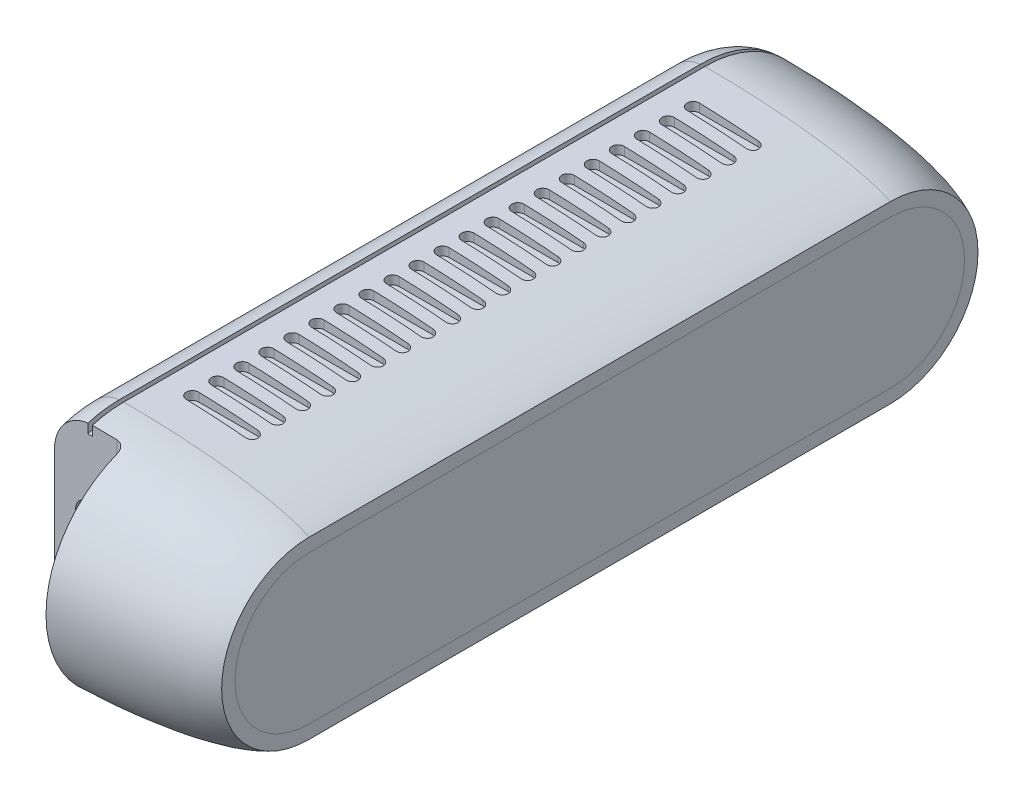
from build123d import *

# Parameters (mm, degrees)
BOSS_EXTRUDE1_DEPTH             = 32.5
REVOLVE1_ANGLE                  = 90
F_3_0MM_DOWEL_HOLE1_D           = 3
F_3_0MM_DOWEL_HOLE1_DEPTH       = 2.348709071
F_3_0MM_DOWEL_HOLE1_TIP         = 0.901290929
CUT_EXTRUDE1_DEPTH              = 53.974050407
CUT_EXTRUDE1_DEPTH_BACK         = 53.974050407
SKETCH13_W                      = 8
SKETCH13_H                      = 9
FILLET1_R                       = 1
CUT_EXTRUDE2_DEPTH              = 1
CUT_EXTRUDE3_DEPTH              = 5
BOSS_EXTRUDE2_REACH             = 59.228
F_1_4_0_25_DIAMETER_HOLE1_D     = 6.35
F_1_4_0_25_DIAMETER_HOLE1_DEPTH = 7.998267535
F_1_4_0_25_DIAMETER_HOLE1_TIP   = 1.907732465
THREAD1_PITCH                   = 1.27
CUT_EXTRUDE4_START              = -24
CUT_EXTRUDE4_DEPTH              = 1


with BuildPart() as part:
    # Sketch1 → Boss-Extrude1 (new body)
    with BuildSketch(Plane.XY):
        with BuildLine():
            Line((0, 0), (0, 8.25))
            ThreePointArc((0, 8.25), (1.072933743, 11.072897448), (3.75, 12.470485754))
            Line((3.75, 12.470485754), (3.75, 11.470485754))
            Line((3.75, 11.470485754), (4.25, 11.470485754))
            Line((4.25, 11.470485754), (4.25, 12.5))
            add(Edge.make_bspline(
                [(25, 9.795819234), (19.465709193, 12.5), (4.25, 12.5)],
                knots=[0.372260651, 0.372260651, 0.372260651, 1.570796327, 1.570796327, 1.570796327], degree=2, weights=[1, 0.825748803, 1]))
            Line((25, 9.795819234), (25, 0))
            Line((25, 0), (0, 0))
        make_face()
    extrude(amount=BOSS_EXTRUDE1_DEPTH)

    # Sketch5 → Revolve1 (revolve)
    with BuildSketch(Plane.XY.offset(32.5)):
        with BuildLine():
            Line((0, 0), (25, 0))
            Line((25, 0), (25, 9.795819234))
            add(Edge.make_bspline(
                [(25, 9.795819234), (19.465709193, 12.5), (4.25, 12.5)],
                knots=[0.372260651, 0.372260651, 0.372260651, 1.570796327, 1.570796327, 1.570796327], degree=2, weights=[1, 0.825748803, 1]))
            Line((4.25, 12.5), (4.25, 11.470485754))
            Line((4.25, 11.470485754), (3.75, 11.470485754))
            Line((3.75, 11.470485754), (3.75, 12.470485754))
            ThreePointArc((3.75, 12.470485754), (1.072933743, 11.072897448), (0, 8.25))
            Line((0, 8.25), (0, 0))
        make_face()
    revolve(axis=Axis((0, 0, 32.5), (1, 0, 0)), revolution_arc=REVOLVE1_ANGLE)

    # Mirror1: part across plane


with BuildPart() as part_1:
    add(part.part)
    add(part.part.mirror(Plane(origin=(4.25, 8.25, 0), x_dir=(1, 0, 0), z_dir=(0, 0, -1))))

    # Mirror2: part across plane


with BuildPart() as part_2:
    add(part_1.part)
    add(part_1.part.mirror(Plane(origin=(25, 0, 32.5), x_dir=(0, 0, 1), z_dir=(0, 1, 0))))

    # Ø3.0mm Dowel Hole1
    with Locations(Plane.ZY):
        with Locations((-22.5, 0), (22.5, 0)):
            Hole(F_3_0MM_DOWEL_HOLE1_D / 2, depth=F_3_0MM_DOWEL_HOLE1_DEPTH)
            with Locations((0, 0, -(F_3_0MM_DOWEL_HOLE1_DEPTH + F_3_0MM_DOWEL_HOLE1_TIP / 2))):  # 118° drill point
                Cone(0, F_3_0MM_DOWEL_HOLE1_D / 2, F_3_0MM_DOWEL_HOLE1_TIP, mode=Mode.SUBTRACT)

    # Sketch13 → Cut-Extrude1 (cut, two sides: drawn at the far end of the back side and taken through both)
    with BuildSketch(Plane(origin=(0, 0, 0), x_dir=(1, 0, 0), z_dir=(0, 1, 0)).offset(-CUT_EXTRUDE1_DEPTH_BACK)):
        with Locations((4, -40.5)):
            Rectangle(SKETCH13_W, SKETCH13_H)
    extrude(amount=CUT_EXTRUDE1_DEPTH + CUT_EXTRUDE1_DEPTH_BACK, mode=Mode.SUBTRACT)

    # Fillet1
    fillet1_edges = [part_2.edges().sort_by_distance(p)[0] for p in [
        (8, 0, 36),
    ]]
    fillet(fillet1_edges, radius=FILLET1_R)

    # Sketch15 → Cut-Extrude2 (cut)
    with BuildSketch(Plane(origin=(0, 12.5, 0), x_dir=(1, 0, 0), z_dir=(0, 1, 0))):
        with BuildLine():
            Line((14.05, -0.7), (7.45, -0.7))
            ThreePointArc((7.45, -0.7), (6.75, 0), (7.45, 0.7))
            Line((7.45, 0.7), (14.05, 0.7))
            ThreePointArc((14.05, 0.7), (14.75, 0), (14.05, -0.7))
        make_face()
        with BuildLine():
            Line((14.05, 2.1), (7.45, 2.1))
            ThreePointArc((7.45, 2.1), (6.75, 2.8), (7.45, 3.5))
            Line((7.45, 3.5), (14.05, 3.5))
            ThreePointArc((14.05, 3.5), (14.75, 2.8), (14.05, 2.1))
        make_face()
        with BuildLine():
            Line((14.05, 4.9), (7.45, 4.9))
            ThreePointArc((7.45, 4.9), (6.75, 5.6), (7.45, 6.3))
            Line((7.45, 6.3), (14.05, 6.3))
            ThreePointArc((14.05, 6.3), (14.75, 5.6), (14.05, 4.9))
        make_face()
        with BuildLine():
            Line((14.05, 7.7), (7.45, 7.7))
            ThreePointArc((7.45, 7.7), (6.75, 8.4), (7.45, 9.1))
            Line((7.45, 9.1), (14.05, 9.1))
            ThreePointArc((14.05, 9.1), (14.75, 8.4), (14.05, 7.7))
        make_face()
        with BuildLine():
            Line((14.05, 10.5), (7.45, 10.5))
            ThreePointArc((7.45, 10.5), (6.75, 11.2), (7.45, 11.9))
            Line((7.45, 11.9), (14.05, 11.9))
            ThreePointArc((14.05, 11.9), (14.75, 11.2), (14.05, 10.5))
        make_face()
        with BuildLine():
            Line((14.05, 13.3), (7.45, 13.3))
            ThreePointArc((7.45, 13.3), (6.75, 14), (7.45, 14.7))
            Line((7.45, 14.7), (14.05, 14.7))
            ThreePointArc((14.05, 14.7), (14.75, 14), (14.05, 13.3))
        make_face()
        with BuildLine():
            Line((14.05, 16.1), (7.45, 16.1))
            ThreePointArc((7.45, 16.1), (6.75, 16.8), (7.45, 17.5))
            Line((7.45, 17.5), (14.05, 17.5))
            ThreePointArc((14.05, 17.5), (14.75, 16.8), (14.05, 16.1))
        make_face()
        with BuildLine():
            Line((14.05, 18.9), (7.45, 18.9))
            ThreePointArc((7.45, 18.9), (6.75, 19.6), (7.45, 20.3))
            Line((7.45, 20.3), (14.05, 20.3))
            ThreePointArc((14.05, 20.3), (14.75, 19.6), (14.05, 18.9))
        make_face()
        with BuildLine():
            Line((14.05, 21.7), (7.45, 21.7))
            ThreePointArc((7.45, 21.7), (6.75, 22.4), (7.45, 23.1))
            Line((7.45, 23.1), (14.05, 23.1))
            ThreePointArc((14.05, 23.1), (14.75, 22.4), (14.05, 21.7))
        make_face()
        with BuildLine():
            Line((14.05, 24.5), (7.45, 24.5))
            ThreePointArc((7.45, 24.5), (6.75, 25.2), (7.45, 25.9))
            Line((7.45, 25.9), (14.05, 25.9))
            ThreePointArc((14.05, 25.9), (14.75, 25.2), (14.05, 24.5))
        make_face()
        with BuildLine():
            Line((14.05, 27.3), (7.45, 27.3))
            ThreePointArc((7.45, 27.3), (6.75, 28), (7.45, 28.7))
            Line((7.45, 28.7), (14.05, 28.7))
            ThreePointArc((14.05, 28.7), (14.75, 28), (14.05, 27.3))
        make_face()
        with BuildLine():
            Line((14.05, -3.5), (7.45, -3.5))
            ThreePointArc((7.45, -3.5), (6.75, -2.8), (7.45, -2.1))
            Line((7.45, -2.1), (14.05, -2.1))
            ThreePointArc((14.05, -2.1), (14.75, -2.8), (14.05, -3.5))
        make_face()
        with BuildLine():
            Line((14.05, -6.3), (7.45, -6.3))
            ThreePointArc((7.45, -6.3), (6.75, -5.6), (7.45, -4.9))
            Line((7.45, -4.9), (14.05, -4.9))
            ThreePointArc((14.05, -4.9), (14.75, -5.6), (14.05, -6.3))
        make_face()
        with BuildLine():
            Line((14.05, -9.1), (7.45, -9.1))
            ThreePointArc((7.45, -9.1), (6.75, -8.4), (7.45, -7.7))
            Line((7.45, -7.7), (14.05, -7.7))
            ThreePointArc((14.05, -7.7), (14.75, -8.4), (14.05, -9.1))
        make_face()
        with BuildLine():
            Line((14.05, -11.9), (7.45, -11.9))
            ThreePointArc((7.45, -11.9), (6.75, -11.2), (7.45, -10.5))
            Line((7.45, -10.5), (14.05, -10.5))
            ThreePointArc((14.05, -10.5), (14.75, -11.2), (14.05, -11.9))
        make_face()
        with BuildLine():
            Line((14.05, -14.7), (7.45, -14.7))
            ThreePointArc((7.45, -14.7), (6.75, -14), (7.45, -13.3))
            Line((7.45, -13.3), (14.05, -13.3))
            ThreePointArc((14.05, -13.3), (14.75, -14), (14.05, -14.7))
        make_face()
        with BuildLine():
            Line((14.05, -17.5), (7.45, -17.5))
            ThreePointArc((7.45, -17.5), (6.75, -16.8), (7.45, -16.1))
            Line((7.45, -16.1), (14.05, -16.1))
            ThreePointArc((14.05, -16.1), (14.75, -16.8), (14.05, -17.5))
        make_face()
        with BuildLine():
            Line((14.05, -20.3), (7.45, -20.3))
            ThreePointArc((7.45, -20.3), (6.75, -19.6), (7.45, -18.9))
            Line((7.45, -18.9), (14.05, -18.9))
            ThreePointArc((14.05, -18.9), (14.75, -19.6), (14.05, -20.3))
        make_face()
        with BuildLine():
            Line((14.05, -23.1), (7.45, -23.1))
            ThreePointArc((7.45, -23.1), (6.75, -22.4), (7.45, -21.7))
            Line((7.45, -21.7), (14.05, -21.7))
            ThreePointArc((14.05, -21.7), (14.75, -22.4), (14.05, -23.1))
        make_face()
        with BuildLine():
            Line((14.05, -25.9), (7.45, -25.9))
            ThreePointArc((7.45, -25.9), (6.75, -25.2), (7.45, -24.5))
            Line((7.45, -24.5), (14.05, -24.5))
            ThreePointArc((14.05, -24.5), (14.75, -25.2), (14.05, -25.9))
        make_face()
        with BuildLine():
            Line((14.05, -28.7), (7.45, -28.7))
            ThreePointArc((7.45, -28.7), (6.75, -28), (7.45, -27.3))
            Line((7.45, -27.3), (14.05, -27.3))
            ThreePointArc((14.05, -27.3), (14.75, -28), (14.05, -28.7))
        make_face()
    extrude(amount=-CUT_EXTRUDE2_DEPTH, mode=Mode.SUBTRACT)

    # Sketch16 → Cut-Extrude3 (cut)
    with BuildSketch(Plane.XY.offset(36)):
        with BuildLine():
            Line((5.37, 2.925), (5.37, -2.925))
            ThreePointArc((5.37, -2.925), (3.87, -4.425), (2.37, -2.925))
            Line((2.37, -2.925), (2.37, 2.925))
            ThreePointArc((2.37, 2.925), (3.87, 4.425), (5.37, 2.925))
        make_face()
    extrude(amount=-CUT_EXTRUDE3_DEPTH, mode=Mode.SUBTRACT)

    # Sketch17 → Boss-Extrude2 (add, up to next)
    with BuildSketch(Plane(origin=(0, -12.5, 0), x_dir=(-1, 0, 0), z_dir=(0, -1, 0)), mode=Mode.PRIVATE) as boss_extrude2_sk1:
        with BuildLine():
            Line((-4.25, -30.5), (-12.041958129, -29.25004005))
            ThreePointArc((-12.041958129, -29.25004005), (-15.055245764, -27.556629293), (-16.25, -24.313158208))
            Line((-16.25, -24.313158208), (-16.25, 24.313158208))
            ThreePointArc((-16.25, 24.313158208), (-15.055245764, 27.556629293), (-12.041958129, 29.25004005))
            Line((-12.041958129, 29.25004005), (-4.25, 30.5))
            Line((-4.25, 30.5), (-4.25, -30.5))
        make_face()
    boss_extrude2_tool1 = extrude(boss_extrude2_sk1.sketch, amount=-BOSS_EXTRUDE2_REACH, mode=Mode.PRIVATE) - part_2.part
    add(boss_extrude2_tool1.solids().sort_by_distance((10.131103, -12.5, 0))[0])

    # 1/4 (0.25) Diameter Hole1
    with Locations(Plane(origin=(0, -12.5, 0), x_dir=(-1, 0, 0), z_dir=(0, -1, 0))):
        with Locations((-9.6475, 0)):
            Hole(F_1_4_0_25_DIAMETER_HOLE1_D / 2, depth=F_1_4_0_25_DIAMETER_HOLE1_DEPTH)
            with Locations((0, 0, -(F_1_4_0_25_DIAMETER_HOLE1_DEPTH + F_1_4_0_25_DIAMETER_HOLE1_TIP / 2))):  # 118° drill point
                Cone(0, F_1_4_0_25_DIAMETER_HOLE1_D / 2, F_1_4_0_25_DIAMETER_HOLE1_TIP, mode=Mode.SUBTRACT)

    # Thread1: the profile of Thread Profile1 profile screwed along a right-hand helix of 6.297848 turns, 8 arcs to a turn; built about Z, then put on its axis
    thread1_z = Axis((0, 0, 0), (0, 0, 1))
    thread1_corners = [(3.1753, 0, -0.000173205), (3.1753, 0, 1.111423202), (2.487592339, 0, 0.714374998), (2.487592339, 0, 0.396874998)]
    with BuildLine(mode=Mode.PRIVATE) as thread1_profile:
        Line(thread1_corners[0], thread1_corners[1])
        Line(thread1_corners[1], thread1_corners[2])
        Line(thread1_corners[2], thread1_corners[3])
        Line(thread1_corners[3], thread1_corners[0])
    thread1_cap = Face(thread1_profile.wire())
    thread1_turn_angles = [0, 22.5, 45, 67.5, 90, 112.5, 135, 157.5, 180, 202.5, 225, 247.5, 270, 292.5, 315, 337.5, 360]
    thread1_turn_weights = [1, 0.9238795325112867, 1, 0.9238795325112867, 1, 0.9238795325112867, 1, 0.9238795325112867, 1, 0.9238795325112867, 1, 0.9238795325112867, 1, 0.9238795325112867, 1, 0.9238795325112867, 1]
    thread1_turn_rails = [Edge.make_bspline([Vector(p[0], p[1], 0).rotate(thread1_z, thread1_turn_angles[k]) / thread1_turn_weights[k] + Vector(0, 0, p[2] + THREAD1_PITCH * thread1_turn_angles[k] / 360) for k in range(17)], [0, 0, 0, 1, 1, 2, 2, 3, 3, 4, 4, 5, 5, 6, 6, 7, 7, 8, 8, 8], 2, thread1_turn_weights) for p in thread1_corners]
    thread1_turn_sides = [Face.make_surface_from_curves(thread1_turn_rails[p[0]], thread1_turn_rails[p[1]]) for p in [(0, 1), (1, 2), (2, 3), (3, 0)]]
    thread1_last_angles = [2160, 2182.5, 2205, 2227.5, 2250, 2258.612721438, 2267.225442875]
    thread1_last_weights = [1, 0.9238795325112867, 1, 0.9238795325112867, 1, 0.9887231551979407, 1]
    thread1_last_rails = [Edge.make_bspline([Vector(p[0], p[1], 0).rotate(thread1_z, thread1_last_angles[k]) / thread1_last_weights[k] + Vector(0, 0, p[2] + THREAD1_PITCH * thread1_last_angles[k] / 360) for k in range(7)], [0, 0, 0, 1, 1, 2, 2, 3, 3, 3], 2, thread1_last_weights) for p in thread1_corners]
    thread1_last_sides = [Face.make_surface_from_curves(thread1_last_rails[p[0]], thread1_last_rails[p[1]]) for p in [(0, 1), (1, 2), (2, 3), (3, 0)]]
    thread1 = Plane(origin=(9.6475, -12.5, 0), x_dir=(1, 0, 0), z_dir=(0, 1, 0)) * Solid(Shell([*[p.moved(Location((0, 0, THREAD1_PITCH * i))) for i in range(6) for p in thread1_turn_sides], *thread1_last_sides, thread1_cap, thread1_cap.rotate(thread1_z, 2267.225442875).moved(Location((0, 0, THREAD1_PITCH * 2267.225442875 / 360)))]))
    add(thread1)

    # Sketch15<2> → Cut-Extrude4 (cut)
    with BuildSketch(Plane(origin=(0, 12.5, 0), x_dir=(1, 0, 0), z_dir=(0, 1, 0)).offset(CUT_EXTRUDE4_START)):
        with BuildLine():
            Line((14.05, 4.9), (7.45, 4.9))
            ThreePointArc((7.45, 4.9), (6.75, 5.6), (7.45, 6.3))
            Line((7.45, 6.3), (14.05, 6.3))
            ThreePointArc((14.05, 6.3), (14.75, 5.6), (14.05, 4.9))
        make_face()
        with BuildLine():
            Line((14.05, 7.7), (7.45, 7.7))
            ThreePointArc((7.45, 7.7), (6.75, 8.4), (7.45, 9.1))
            Line((7.45, 9.1), (14.05, 9.1))
            ThreePointArc((14.05, 9.1), (14.75, 8.4), (14.05, 7.7))
        make_face()
        with BuildLine():
            Line((14.05, 10.5), (7.45, 10.5))
            ThreePointArc((7.45, 10.5), (6.75, 11.2), (7.45, 11.9))
            Line((7.45, 11.9), (14.05, 11.9))
            ThreePointArc((14.05, 11.9), (14.75, 11.2), (14.05, 10.5))
        make_face()
        with BuildLine():
            Line((14.05, 13.3), (7.45, 13.3))
            ThreePointArc((7.45, 13.3), (6.75, 14), (7.45, 14.7))
            Line((7.45, 14.7), (14.05, 14.7))
            ThreePointArc((14.05, 14.7), (14.75, 14), (14.05, 13.3))
        make_face()
        with BuildLine():
            Line((14.05, 16.1), (7.45, 16.1))
            ThreePointArc((7.45, 16.1), (6.75, 16.8), (7.45, 17.5))
            Line((7.45, 17.5), (14.05, 17.5))
            ThreePointArc((14.05, 17.5), (14.75, 16.8), (14.05, 16.1))
        make_face()
        with BuildLine():
            Line((14.05, 18.9), (7.45, 18.9))
            ThreePointArc((7.45, 18.9), (6.75, 19.6), (7.45, 20.3))
            Line((7.45, 20.3), (14.05, 20.3))
            ThreePointArc((14.05, 20.3), (14.75, 19.6), (14.05, 18.9))
        make_face()
        with BuildLine():
            Line((14.05, 21.7), (7.45, 21.7))
            ThreePointArc((7.45, 21.7), (6.75, 22.4), (7.45, 23.1))
            Line((7.45, 23.1), (14.05, 23.1))
            ThreePointArc((14.05, 23.1), (14.75, 22.4), (14.05, 21.7))
        make_face()
        with BuildLine():
            Line((14.05, 24.5), (7.45, 24.5))
            ThreePointArc((7.45, 24.5), (6.75, 25.2), (7.45, 25.9))
            Line((7.45, 25.9), (14.05, 25.9))
            ThreePointArc((14.05, 25.9), (14.75, 25.2), (14.05, 24.5))
        make_face()
        with BuildLine():
            Line((14.05, -6.3), (7.45, -6.3))
            ThreePointArc((7.45, -6.3), (6.75, -5.6), (7.45, -4.9))
            Line((7.45, -4.9), (14.05, -4.9))
            ThreePointArc((14.05, -4.9), (14.75, -5.6), (14.05, -6.3))
        make_face()
        with BuildLine():
            Line((14.05, -9.1), (7.45, -9.1))
            ThreePointArc((7.45, -9.1), (6.75, -8.4), (7.45, -7.7))
            Line((7.45, -7.7), (14.05, -7.7))
            ThreePointArc((14.05, -7.7), (14.75, -8.4), (14.05, -9.1))
        make_face()
        with BuildLine():
            Line((14.05, -11.9), (7.45, -11.9))
            ThreePointArc((7.45, -11.9), (6.75, -11.2), (7.45, -10.5))
            Line((7.45, -10.5), (14.05, -10.5))
            ThreePointArc((14.05, -10.5), (14.75, -11.2), (14.05, -11.9))
        make_face()
        with BuildLine():
            Line((14.05, -14.7), (7.45, -14.7))
            ThreePointArc((7.45, -14.7), (6.75, -14), (7.45, -13.3))
            Line((7.45, -13.3), (14.05, -13.3))
            ThreePointArc((14.05, -13.3), (14.75, -14), (14.05, -14.7))
        make_face()
        with BuildLine():
            Line((14.05, -17.5), (7.45, -17.5))
            ThreePointArc((7.45, -17.5), (6.75, -16.8), (7.45, -16.1))
            Line((7.45, -16.1), (14.05, -16.1))
            ThreePointArc((14.05, -16.1), (14.75, -16.8), (14.05, -17.5))
        make_face()
        with BuildLine():
            Line((14.05, -20.3), (7.45, -20.3))
            ThreePointArc((7.45, -20.3), (6.75, -19.6), (7.45, -18.9))
            Line((7.45, -18.9), (14.05, -18.9))
            ThreePointArc((14.05, -18.9), (14.75, -19.6), (14.05, -20.3))
        make_face()
        with BuildLine():
            Line((14.05, -23.1), (7.45, -23.1))
            ThreePointArc((7.45, -23.1), (6.75, -22.4), (7.45, -21.7))
            Line((7.45, -21.7), (14.05, -21.7))
            ThreePointArc((14.05, -21.7), (14.75, -22.4), (14.05, -23.1))
        make_face()
        with BuildLine():
            Line((14.05, -25.9), (7.45, -25.9))
            ThreePointArc((7.45, -25.9), (6.75, -25.2), (7.45, -24.5))
            Line((7.45, -24.5), (14.05, -24.5))
            ThreePointArc((14.05, -24.5), (14.75, -25.2), (14.05, -25.9))
        make_face()
    extrude(amount=-CUT_EXTRUDE4_DEPTH, mode=Mode.SUBTRACT)


solid = part_2.part
